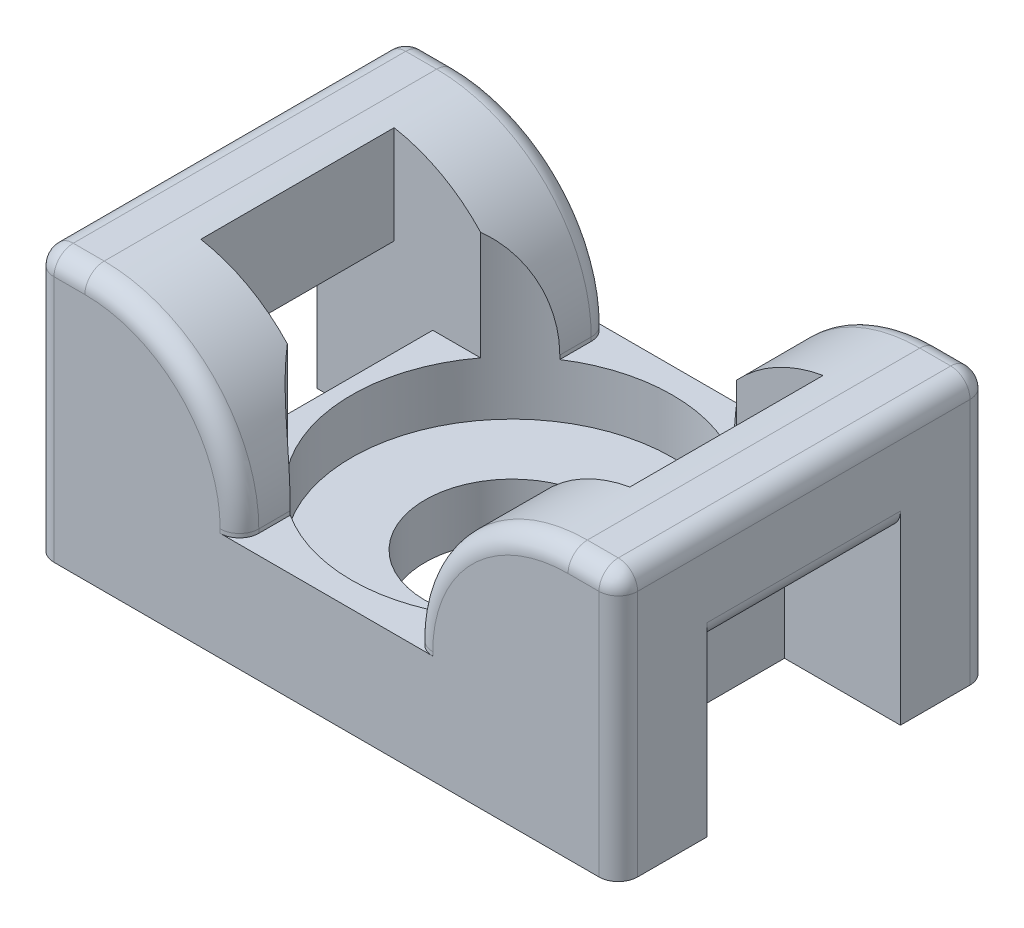
from build123d import *

# Parameters (mm, degrees)
SKETCH1_W           = 15.1
SKETCH1_H           = 9.6
BOSS_EXTRUDE1_DEPTH = 6.9
SKETCH3_R           = 2.25
CUT_EXTRUDE1_DEPTH  = 12.298340586
SKETCH4_R           = 4.15
CUT_EXTRUDE2_DEPTH  = 5.5
SKETCH5_W           = 15.1
SKETCH5_H           = 5
CUT_EXTRUDE3_DEPTH  = 4.1
SKETCH6_W           = 4.5
SKETCH6_H           = 4.1
CUT_EXTRUDE4_DEPTH  = 11.4
SKETCH9_W           = 5
SKETCH9_H           = 2.8
CUT_EXTRUDE5_DEPTH  = 3
FILLET3_R           = 0.5
BOSS_EXTRUDE2_REACH = 14.566
SKETCH10_W          = 2
SKETCH10_H          = 2.6
FILLET4_R           = 4
FILLET5_R           = 0.5
FILLET6_R           = 0.5


with BuildPart() as part:
    # Sketch1 → Boss-Extrude1 (new body)
    with BuildSketch(Plane(origin=(0, 0, 0), x_dir=(1, 0, 0), z_dir=(0, 1, 0))):
        Rectangle(SKETCH1_W, SKETCH1_H)
    extrude(amount=BOSS_EXTRUDE1_DEPTH)

    # Sketch3 → Cut-Extrude1 (cut, through all)
    with BuildSketch(Plane(origin=(0, 6.9, 0), x_dir=(1, 0, 0), z_dir=(0, 1, 0))):
        with Locations(Location((0, 0, 0), (0, 0, 270))):
            Circle(SKETCH3_R)
    extrude(amount=-CUT_EXTRUDE1_DEPTH, mode=Mode.SUBTRACT)

    # Sketch4 → Cut-Extrude2 (cut)
    with BuildSketch(Plane(origin=(0, 6.9, 0), x_dir=(1, 0, 0), z_dir=(0, 1, 0))):
        with Locations(Location((0, 0, 0), (0, 0, 270))):
            Circle(SKETCH4_R)
    extrude(amount=-CUT_EXTRUDE2_DEPTH, mode=Mode.SUBTRACT)

    # Sketch5 → Cut-Extrude3 (cut)
    with BuildSketch(Plane(origin=(0, 6.9, 0), x_dir=(1, 0, 0), z_dir=(0, 1, 0))):
        Rectangle(SKETCH5_W, SKETCH5_H)
    extrude(amount=-CUT_EXTRUDE3_DEPTH, mode=Mode.SUBTRACT)

    # Sketch6 → Cut-Extrude4 (cut, symmetric)
    with BuildSketch(Plane.XY):
        with Locations((0, 4.85)):
            Rectangle(SKETCH6_W, SKETCH6_H)
    extrude(amount=CUT_EXTRUDE4_DEPTH, both=True, mode=Mode.SUBTRACT)

    # Sketch9 → Cut-Extrude5 (cut)
    with BuildSketch(Plane.ZY.offset(7.55)):
        with Locations((0, 1.4)):
            Rectangle(SKETCH9_W, SKETCH9_H)
    cut_extrude5 = extrude(amount=-CUT_EXTRUDE5_DEPTH, mode=Mode.SUBTRACT)

    # Fillet3
    fillet3_edges = [part.edges().sort_by_distance(p)[0] for p in [
        (7.55, 3.45, 4.8),
        (-7.55, 3.45, 4.8),
        (-7.55, 3.45, -4.8),
        (7.55, 3.45, -4.8),
    ]]
    fillet(fillet3_edges, radius=FILLET3_R)

    # Sketch10 → Boss-Extrude2 (add, up to next)
    with BuildSketch(Plane.XY.offset(-2.5), mode=Mode.PRIVATE) as boss_extrude2_sk1:
        with Locations((-6.55, 5.6)):
            Rectangle(SKETCH10_W, SKETCH10_H)
    boss_extrude2_tool1 = extrude(boss_extrude2_sk1.sketch, amount=BOSS_EXTRUDE2_REACH, mode=Mode.PRIVATE) - part.part
    boss_extrude2 = boss_extrude2_tool1.solids().sort_by_distance((-6.55, 5.6, -2.5))[0]
    add(boss_extrude2)

    # Mirror1: Cut-Extrude5, Boss-Extrude2 across plane
    add(cut_extrude5.mirror(Plane(origin=(0, 0, 0), x_dir=(0, 0, 1), z_dir=(1, 0, 0))), mode=Mode.SUBTRACT)
    add(boss_extrude2.mirror(Plane(origin=(0, 0, 0), x_dir=(0, 0, 1), z_dir=(1, 0, 0))))

    # Fillet4
    # the kernel refuses this fillet: 4 mm, written as the material it takes off along each edge
    with BuildSketch(Plane(origin=(2.25, 6.9, -14.8), x_dir=(0, -1, 0), z_dir=(0, 0, 1)), Plane(origin=(-2.25, 6.9, 6.512880845), x_dir=(0, -1, 0), z_dir=(0, 0, -1))) as fillet4_piece_1:
        with BuildLine():
            CenterArc((FILLET4_R, FILLET4_R), FILLET4_R, 180, 90)
            Line((0, FILLET4_R), (0, 0))
            Line((0, 0), (FILLET4_R, 0))
        make_face()
    extrude(amount=21.312880845, mode=Mode.SUBTRACT)

    # Fillet5
    fillet5_edges = [part.edges().sort_by_distance(p)[0] for p in [
        (6.65, 6.9, -4.8),
        (7.403553391, 6.9, -4.653553391),
        (-6.65, 6.9, 4.8),
        (7.403553391, 6.9, 4.653553391),
        (-7.403553391, 6.9, 4.653553391),
        (-7.403553391, 6.9, -4.653553391),
        (6.65, 6.9, 4.8),
        (2.25, 2.85, 4.8),
        (3.421572875, 5.728427125, 4.8),
        (-3.421572875, 5.728427125, 4.8),
        (-6.65, 6.9, -4.8),
        (-2.25, 2.85, -4.8),
        (-3.421572875, 5.728427125, -4.8),
        (3.421572875, 5.728427125, -4.8),
        (7.55, 6.9, 0),
        (-7.55, 6.9, 0),
        (-2.25, 2.85, 4.8),
        (2.25, 2.85, -4.8),
    ]]
    fillet(fillet5_edges, radius=FILLET5_R)

    # Fillet6
    fillet6_edges = [part.edges().sort_by_distance(p)[0] for p in [
        (-7.55, 4.3, 0),
        (7.55, 4.3, 0),
    ]]
    fillet(fillet6_edges, radius=FILLET6_R)


solid = part.part
